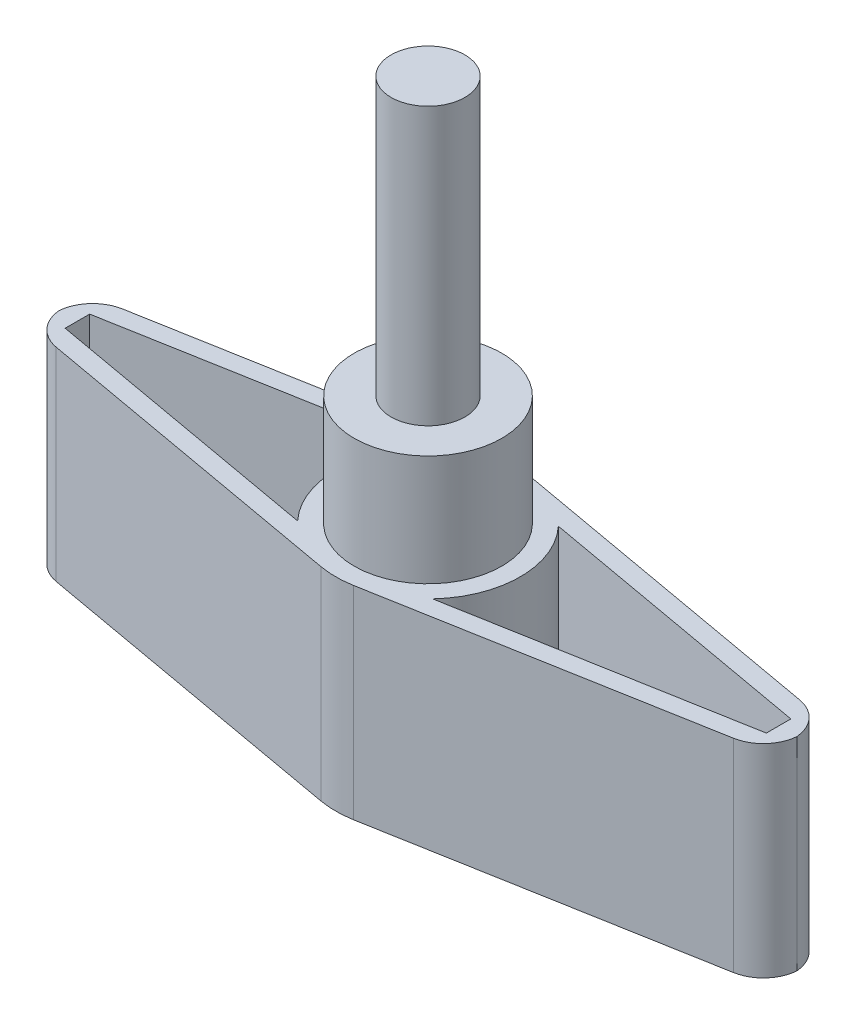
from build123d import *

# Parameters (mm, degrees)
BOSS_EXTRUDE1_DEPTH = 10
BOSS_EXTRUDE2_START = 1
BOSS_EXTRUDE2_DEPTH = 1
SKETCH3_R           = 4
BOSS_EXTRUDE3_DEPTH = 6
SKETCH4_R           = 2
BOSS_EXTRUDE4_DEPTH = 15
FILLET1_R           = 2


with BuildPart() as part:
    # Sketch1 → Boss-Extrude1 (new body)
    with BuildSketch(Plane(origin=(0, 0, 0), x_dir=(1, 0, 0), z_dir=(0, 1, 0))):
        with BuildLine():
            Line((-20.000157194, 1.500878546), (-20.000157194, -1.500878546))
            Line((-20.000157194, -1.500878546), (-0.880639137, -4.921836518))
            ThreePointArc((-0.880639137, -4.921836518), (0, -5), (0.880639137, -4.921836518))
            Line((0.880639137, -4.921836518), (20.000157194, -1.500878546))
            Line((20.000157194, -1.500878546), (20.000157194, 1.500878546))
            Line((20.000157194, 1.500878546), (0.880639137, 4.921836518))
            ThreePointArc((0.880639137, 4.921836518), (0, 5), (-0.880639137, 4.921836518))
            Line((-0.880639137, 4.921836518), (-20.000157194, 1.500878546))
        make_face()
        with BuildLine():
            Line((-19.000157194, -0.663922493), (-19.000157194, 0.663922493))
            Line((-19.000157194, 0.663922493), (-18.824029366, 0.695436148))
            Line((-18.824029366, 0.695436148), (-3.65761322, 3.409085733))
            ThreePointArc((-3.65761322, 3.409085733), (-5, 0), (-3.65761322, -3.409085733))
            Line((-3.65761322, -3.409085733), (-18.824029366, -0.695436148))
            Line((-18.824029366, -0.695436148), (-19.000157194, -0.663922493))
        make_face(mode=Mode.SUBTRACT)
        with BuildLine():
            Line((18.824029366, 0.695436148), (19.000157194, 0.663922493))
            Line((19.000157194, 0.663922493), (19.000157194, -0.663922493))
            Line((19.000157194, -0.663922493), (18.824029366, -0.695436148))
            Line((18.824029366, -0.695436148), (3.65761322, -3.409085733))
            ThreePointArc((3.65761322, -3.409085733), (5, 0), (3.65761322, 3.409085733))
            Line((3.65761322, 3.409085733), (18.824029366, 0.695436148))
        make_face(mode=Mode.SUBTRACT)
    extrude(amount=BOSS_EXTRUDE1_DEPTH)

    # Sketch2 → Boss-Extrude2 (add)
    with BuildSketch(Plane.XZ.offset(BOSS_EXTRUDE2_START)):
        with BuildLine():
            Line((-20.000157194, 1.500878546), (-0.880639137, 4.921836518))
            ThreePointArc((-0.880639137, 4.921836518), (0, 5), (0.880639137, 4.921836518))
            Line((0.880639137, 4.921836518), (20.000157194, 1.500878546))
            Line((20.000157194, 1.500878546), (20.000157194, -1.500878546))
            Line((20.000157194, -1.500878546), (0.880639137, -4.921836518))
            ThreePointArc((0.880639137, -4.921836518), (0, -5), (-0.880639137, -4.921836518))
            Line((-0.880639137, -4.921836518), (-20.000157194, -1.500878546))
            Line((-20.000157194, -1.500878546), (-20.000157194, 1.500878546))
        make_face()
    extrude(amount=-BOSS_EXTRUDE2_DEPTH)

    # Sketch3 → Boss-Extrude3 (add)
    with BuildSketch(Plane(origin=(0, 10, 0), x_dir=(1, 0, 0), z_dir=(0, 1, 0))):
        with Locations(Location((0, 0, 0), (0, 0, 270))):
            Circle(SKETCH3_R)
    extrude(amount=BOSS_EXTRUDE3_DEPTH)

    # Sketch4 → Boss-Extrude4 (add)
    with BuildSketch(Plane(origin=(0, 16, 0), x_dir=(1, 0, 0), z_dir=(0, 1, 0))):
        with Locations(Location((0, 0, 0), (0, 0, 270))):
            Circle(SKETCH4_R)
    extrude(amount=BOSS_EXTRUDE4_DEPTH)

    # Fillet1
    # the kernel refuses this fillet: 2 mm, written as the material it takes off along each edge
    with BuildSketch(Plane(origin=(20.000157194, -5.184780263, 1.500878546), x_dir=(-0.9843673036221247, 0, 0.17612782732920945), z_dir=(0, 1, 0)), Plane(origin=(20.000157194, -5.184780263, -1.500878546), x_dir=(0, 0, 1), z_dir=(0, 1, 0)), Plane(origin=(-20.000157194, 14.184780263, 1.500878546), x_dir=(0.9843673036221245, 0, 0.17612782732920956), z_dir=(0, -1, 0))) as fillet1_piece_1:
        with BuildLine():
            CenterArc((FILLET1_R * 0.836956052521, -FILLET1_R), FILLET1_R, 90, 79.855702636)
            Line((-FILLET1_R * 0.147411251101, -FILLET1_R * 0.823872172671), (0, 0))
            Line((0, 0), (FILLET1_R * 0.836956052521, 0))
        make_face()
    extrude(amount=19.369560525, mode=Mode.SUBTRACT)
    with BuildSketch(Plane(origin=(-20.000157194, -5.184780263, -1.500878546), x_dir=(0, 0, 1), z_dir=(0, 1, 0))) as fillet1_piece_2:
        with BuildLine():
            CenterArc((FILLET1_R * 0.836956052521, FILLET1_R), FILLET1_R, 190.144297364, 79.855702636)
            Line((-FILLET1_R * 0.147411251101, FILLET1_R * 0.823872172671), (0, 0))
            Line((0, 0), (FILLET1_R * 0.836956052521, 0))
        make_face()
    extrude(amount=19.369560525, mode=Mode.SUBTRACT)


solid = part.part
